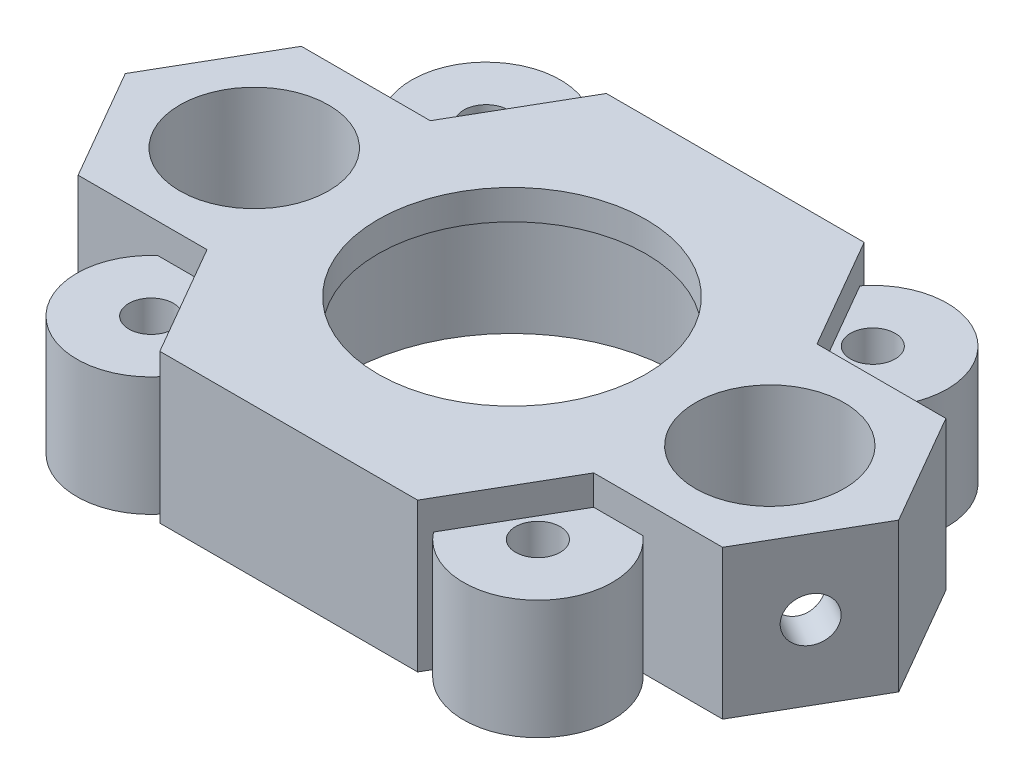
from build123d import *

# Parameters (mm, degrees)
SKETCH1_R                      = 1.5
SKETCH1_R_2                    = 5
BOSS_EXTRUDE1_DEPTH            = 8
SKETCH2_R                      = 9
SKETCH2_R_2                    = 5
BOSS_EXTRUDE2_DEPTH            = 2
CUT_EXTRUDE1_REACH             = 56.069
CUT_EXTRUDE1_END_RADIUS        = 5
SKETCH4_R                      = 1.5
CUT_EXTRUDE1_DIRECTION_2_DEPTH = 55.068821885
CUT_EXTRUDE2_REACH             = 56.069
CUT_EXTRUDE2_END_RADIUS        = 5
SKETCH5_R                      = 1.5


with BuildPart() as part:
    # Sketch1 → Boss-Extrude1 (new body)
    with BuildSketch(Plane(origin=(0, 0, 0), x_dir=(1, 0, 0), z_dir=(0, 1, 0))):
        with BuildLine():
            Line((9.049021397, 14.326635181), (8.660254038, 15))
            Line((8.660254038, 15), (-8.660254038, 15))
            Line((-8.660254038, 15), (-9.049021397, 14.326635181))
            ThreePointArc((-9.049021397, 14.326635181), (-16.418395064, 14.889879114), (-16.297570196, 7.5))
            Line((-16.297570196, 7.5), (-21.650635095, 7.5))
            Line((-21.650635095, 7.5), (-25.980762114, 0))
            Line((-25.980762114, 0), (-21.650635095, -7.5))
            Line((-21.650635095, -7.5), (-16.297570196, -7.5))
            ThreePointArc((-16.297570196, -7.5), (-16.418395064, -14.889879114), (-9.049021397, -14.326635181))
            Line((-9.049021397, -14.326635181), (-8.660254038, -15))
            Line((-8.660254038, -15), (8.660254038, -15))
            Line((8.660254038, -15), (9.049021397, -14.326635181))
            ThreePointArc((9.049021397, -14.326635181), (16.418395064, -14.889879114), (16.297570196, -7.5))
            Line((16.297570196, -7.5), (21.650635095, -7.5))
            Line((21.650635095, -7.5), (25.980762114, 0))
            Line((25.980762114, 0), (21.650635095, 7.5))
            Line((21.650635095, 7.5), (16.297570196, 7.5))
            ThreePointArc((16.297570196, 7.5), (16.418395064, 14.889879114), (9.049021397, 14.326635181))
        make_face()
        with Locations((-12.990381057, -11.25)):
            Circle(SKETCH1_R, mode=Mode.SUBTRACT)
        with Locations((12.990381057, -11.25)):
            Circle(SKETCH1_R, mode=Mode.SUBTRACT)
        with Locations((-17.320508076, 0)):
            Circle(SKETCH1_R_2, mode=Mode.SUBTRACT)
        with BuildLine():
            ThreePointArc((10.603585136, 3.365948198), (10.993873513, 1.703047322), (11.125, 0))
            ThreePointArc((11.125, 0), (-10.993873513, -1.703047322), (10.603585136, 3.365948198))
        make_face(mode=Mode.SUBTRACT)
        with Locations((-12.990381057, 11.25)):
            Circle(SKETCH1_R, mode=Mode.SUBTRACT)
        with Locations((17.320508076, 0)):
            Circle(SKETCH1_R_2, mode=Mode.SUBTRACT)
        with Locations((12.990381057, 11.25)):
            Circle(SKETCH1_R, mode=Mode.SUBTRACT)
    extrude(amount=BOSS_EXTRUDE1_DEPTH)

    # Sketch2 → Boss-Extrude2 (add)
    with BuildSketch(Plane(origin=(0, 8, 0), x_dir=(1, 0, 0), z_dir=(0, 1, 0))):
        Polygon((-8.660254038, 15), (-12.990381057, 7.5), (-21.650635095, 7.5), (-25.980762114, 0), (-21.650635095, -7.5), (-12.990381057, -7.5), (-8.660254038, -15), (8.660254038, -15), (12.990381057, -7.5), (21.650635095, -7.5), (25.980762114, 0), (21.650635095, 7.5), (12.990381057, 7.5), (8.660254038, 15), align=None)
        Circle(SKETCH2_R, mode=Mode.SUBTRACT)
        with Locations((-17.320508076, 0)):
            Circle(SKETCH2_R_2, mode=Mode.SUBTRACT)
        with Locations((17.320508076, 0)):
            Circle(SKETCH2_R_2, mode=Mode.SUBTRACT)
    extrude(amount=BOSS_EXTRUDE2_DEPTH)

    # Cut-Extrude1: up to this cylinder (the profile starts outside it)
    cut_extrude1_end = Plane(origin=(-17.320508076, 5, 0), z_dir=(0, -1, 0)) * Cylinder(CUT_EXTRUDE1_END_RADIUS, 123.138, mode=Mode.PRIVATE)
    # Sketch4 → Cut-Extrude1 (cut, up to the surface)
    with BuildSketch(Plane(origin=(-19.485571585, 0, 11.25), x_dir=(0.500000000000001, 0, 0.866025403784438), z_dir=(-0.866025403784438, 0, 0.500000000000001)), mode=Mode.PRIVATE) as cut_extrude1_sk1:
        with Locations((-8.660254038, 5)):
            Circle(SKETCH4_R)
    cut_extrude1_tool1 = extrude(cut_extrude1_sk1.sketch, amount=-CUT_EXTRUDE1_REACH, mode=Mode.PRIVATE) - cut_extrude1_end
    add(cut_extrude1_tool1.solids().sort_by_distance((-23.815699, 5, 3.75))[0], mode=Mode.SUBTRACT)

    # Sketch4 → Cut-Extrude1 direction 2 (cut)
    with BuildSketch(Plane(origin=(-19.485571585, 0, 11.25), x_dir=(0.500000000000001, 0, 0.866025403784438), z_dir=(-0.866025403784438, 0, 0.500000000000001))):
        with Locations((-8.660254038, 5)):
            Circle(SKETCH4_R)
    extrude(amount=CUT_EXTRUDE1_DIRECTION_2_DEPTH, mode=Mode.SUBTRACT)

    # Cut-Extrude2: up to this cylinder (the profile starts outside it)
    cut_extrude2_end = Plane(origin=(17.320508076, 5, 0), z_dir=(0, -1, 0)) * Cylinder(CUT_EXTRUDE2_END_RADIUS, 123.138, mode=Mode.PRIVATE)
    # Sketch5 → Cut-Extrude2 (cut, up to the surface)
    with BuildSketch(Plane(origin=(19.485571585, 0, 11.25), x_dir=(0.5000000000000004, 0, -0.8660254037844384), z_dir=(0.8660254037844384, 0, 0.5000000000000004)), mode=Mode.PRIVATE) as cut_extrude2_sk1:
        with Locations((8.660254038, 5)):
            Circle(SKETCH5_R)
    cut_extrude2_tool1 = extrude(cut_extrude2_sk1.sketch, amount=-CUT_EXTRUDE2_REACH, mode=Mode.PRIVATE) - cut_extrude2_end
    add(cut_extrude2_tool1.solids().sort_by_distance((23.815699, 5, 3.75))[0], mode=Mode.SUBTRACT)


solid = part.part
